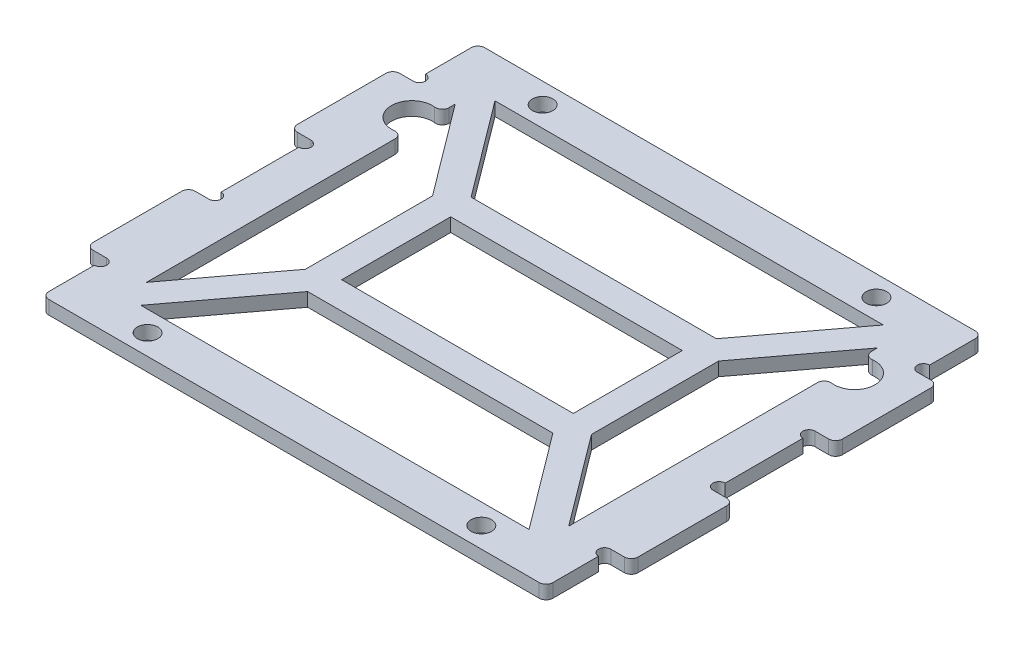
from build123d import *

# Parameters (mm, degrees)
SKETCH_1_R            = 1.5
EXTRUDE_1_DEPTH       = 2
SKETCH_2_R            = 0.9
SKETCH_2_W            = 62
SKETCH_2_H            = 52
CUT_EXTRUDE_1_DEPTH   = 52.264022472
EXTRUDE_START         = -2
EXTRUDE_1_2_OUTLINE_W = 34
EXTRUDE_1_2_OUTLINE_H = 16
EXTRUDE_1_2_DEPTH     = 2
SKETCH_4_R            = 3
CUT_EXTRUDE_2_DEPTH   = 52.264022472
FILLET_1_R            = 1


# Read off the part's stored shape, not the designer's step: 拉伸-薄壁1
with BuildPart() as part:
    # 草图1 → Extrude 1 (new body)
    with BuildSketch(Plane(origin=(0, 0, 0), x_dir=(1, 0, 0), z_dir=(0, 1, 0))):
        Polygon((-37, 32), (-37, 22.5), (-40, 22.5), (-40, 7.5), (-37, 7.5), (-37, -7.5), (-40, -7.5), (-40, -22.5), (-37, -22.5), (-37, -32), (37, -32), (37, -22.5), (40, -22.5), (40, -7.5), (37, -7.5), (37, 7.5), (40, 7.5), (40, 22.5), (37, 22.5), (37, 32), align=None)
        with Locations(Location((-24.5, 29, 0), (0, 0, 270))):
            Circle(SKETCH_1_R, mode=Mode.SUBTRACT)
        with Locations(Location((24.5, 29, 0), (0, 0, 90))):
            Circle(SKETCH_1_R, mode=Mode.SUBTRACT)
        with Locations(Location((24.5, -29, 0), (0, 0, 270))):
            Circle(SKETCH_1_R, mode=Mode.SUBTRACT)
        with Locations(Location((-24.5, -29, 0), (0, 0, 90))):
            Circle(SKETCH_1_R, mode=Mode.SUBTRACT)
    extrude(amount=EXTRUDE_1_DEPTH)

    # 草图2 → 切除-拉伸1 (cut, through all)
    with BuildSketch(Plane(origin=(0, 2, 0), x_dir=(1, 0, 0), z_dir=(0, 1, 0))):
        with Locations((-37, 23.4)):
            Circle(SKETCH_2_R)
        with Locations((-37, 6.6)):
            Circle(SKETCH_2_R)
        with Locations((37, 6.6)):
            Circle(SKETCH_2_R)
        with Locations((37, 23.4)):
            Circle(SKETCH_2_R)
        with Locations((37, -23.4)):
            Circle(SKETCH_2_R)
        with Locations((-37, -23.4)):
            Circle(SKETCH_2_R)
        with Locations((37, -6.6)):
            Circle(SKETCH_2_R)
        with Locations((-37, -6.6)):
            Circle(SKETCH_2_R)
        Rectangle(SKETCH_2_W, SKETCH_2_H)
    extrude(amount=-CUT_EXTRUDE_1_DEPTH, mode=Mode.SUBTRACT)

    # Extrude 1 2 outline → Extrude 1 2 (add)
    with BuildSketch(Plane(origin=(0, 2, 0), x_dir=(1, 0, 0), z_dir=(0, 1, 0)).offset(EXTRUDE_START)):
        Polygon((-31, 26), (-31, 22.666666667), (-21, 9.333333333), (-21, -9.333333333), (-31, -22.666666667), (-31, -26), (-28.5, -26), (-18, -12), (18, -12), (28.5, -26), (31, -26), (31, -22.666666667), (21, -9.333333333), (21, 9.333333333), (31, 22.666666667), (31, 26), (28.5, 26), (18, 12), (-18, 12), (-28.5, 26), align=None)
        Rectangle(EXTRUDE_1_2_OUTLINE_W, EXTRUDE_1_2_OUTLINE_H, mode=Mode.SUBTRACT)
    extrude(amount=EXTRUDE_1_2_DEPTH)

    # 草图4 → 切除-拉伸2 (cut, through all)
    with BuildSketch(Plane(origin=(0, 2, 0), x_dir=(1, 0, 0), z_dir=(0, 1, 0))):
        with Locations((-32.5, 17.8)):
            Circle(SKETCH_4_R)
        with Locations((32.5, 17.8)):
            Circle(SKETCH_4_R)
    extrude(amount=-CUT_EXTRUDE_2_DEPTH, mode=Mode.SUBTRACT)

    # 圆角1
    fillet_1_edges = [part.edges().sort_by_distance(p)[0] for p in [
        (-31, 1, -15.201923789),
        (-31, 1, -20.398076211),
        (31, 1, -20.398076211),
        (31, 1, -15.201923789),
        (37, 1, -32),
        (40, 1, -22.5),
        (40, 1, -7.5),
        (40, 1, 7.5),
        (40, 1, 22.5),
        (37, 1, 32),
        (-37, 1, 32),
        (-40, 1, 22.5),
        (-40, 1, 7.5),
        (-40, 1, -7.5),
        (-40, 1, -22.5),
        (-37, 1, -32),
    ]]
    fillet(fillet_1_edges, radius=FILLET_1_R)


solid = part.part
